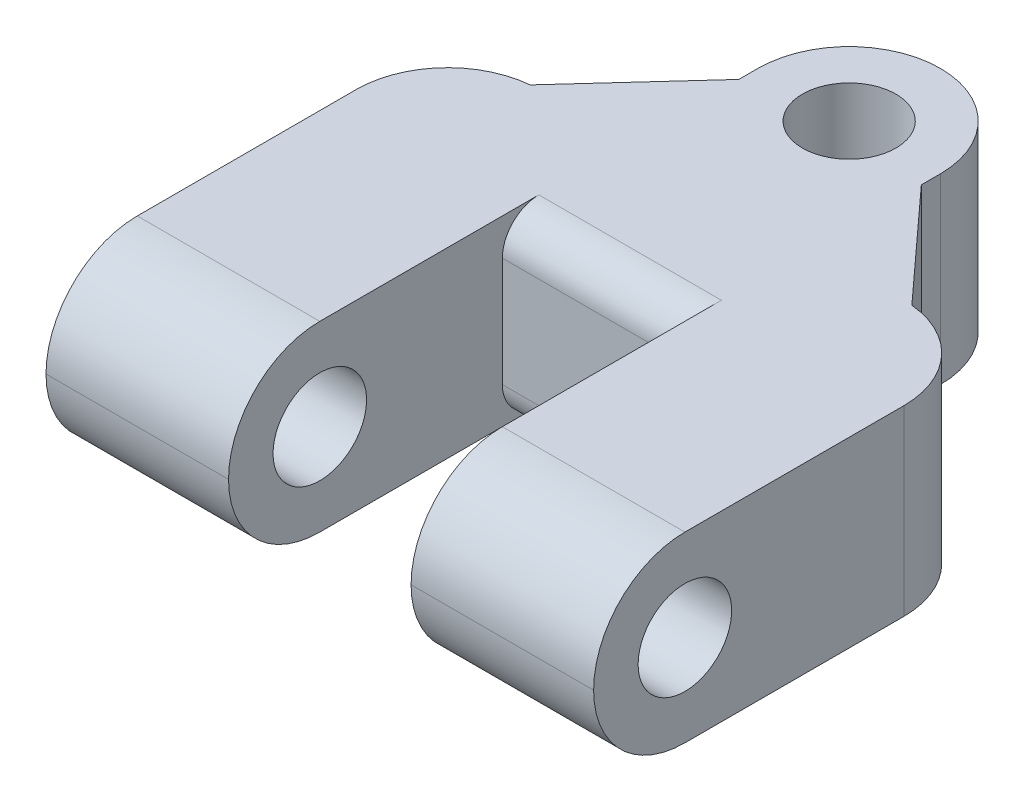
from build123d import *

# Parameters (mm, degrees)
BOSS_EXTRUDE1_DEPTH = 3.175
FILLET1_R           = 3.175
CUT_EXTRUDE1_REACH  = 24.125
SKETCH2_R           = 1.627
SKETCH3_R           = 1.627
CUT_EXTRUDE2_DEPTH  = 6.35
SKETCH4_W           = 6.35
SKETCH4_H           = 6.35
CUT_EXTRUDE3_DEPTH  = 1.905
FILLET2_R           = 1.27
CHAMFER1_START      = -3.175
CHAMFER1_DEPTH      = 6.35


with BuildPart() as part:
    # Sketch1 → Boss-Extrude1 (new, symmetric)
    with BuildSketch(Plane(origin=(0, 0, 0), x_dir=(1, 0, 0), z_dir=(0, 1, 0))):
        Polygon((-3.175, 3.175), (-9.525, 3.175), (-9.525, -3.175), (-9.525, -10.795), (-3.175, -10.795), (-3.175, -3.175), (3.175, -3.175), (3.175, -10.795), (9.525, -10.795), (9.525, -3.175), (9.525, 3.175), (3.175, 3.175), (3.175, 10.795), (-3.175, 10.795), align=None)
    extrude(amount=BOSS_EXTRUDE1_DEPTH, both=True)

    # Fillet1
    fillet1_edges = [part.edges().sort_by_distance(p)[0] for p in [
        (3.175, 0, -10.795),
        (-3.175, 0, -10.795),
        (6.35, -3.175, 10.795),
        (6.35, 3.175, 10.795),
        (-6.35, -3.175, 10.795),
        (-6.35, 3.175, 10.795),
        (-9.525, 0, -3.175),
        (9.525, 0, -3.175),
    ]]
    fillet(fillet1_edges, radius=FILLET1_R - 0.0001)  # a hair under: the kernel refuses the full size

    # Cut-Extrude1: up to this face of the body (flat: up to its plane)
    cut_extrude1_end = Plane(part.part.faces().sort_by_distance((9.525, 0, 5.081615958))[0])
    # Sketch2 → Cut-Extrude1 (cut, up to the picked face)
    with BuildSketch(Plane.ZY.offset(9.525), mode=Mode.PRIVATE) as cut_extrude1_sk1:
        with Locations((7.62, 0)):
            Circle(SKETCH2_R)
    cut_extrude1_tool1 = split(extrude(cut_extrude1_sk1.sketch, amount=-CUT_EXTRUDE1_REACH, mode=Mode.PRIVATE), bisect_by=cut_extrude1_end, keep=Keep.BOTH, mode=Mode.PRIVATE)
    add(cut_extrude1_tool1.solids().sort_by(Axis((-9.525, 0, 7.62), (1, 0, 0)))[0], mode=Mode.SUBTRACT)

    # Sketch3 → Cut-Extrude2 (cut)
    with BuildSketch(Plane(origin=(0, 3.175, 0), x_dir=(1, 0, 0), z_dir=(0, 1, 0))):
        with Locations(Location((0, 7.62, 0), (0, 0, 270))):
            Circle(SKETCH3_R)
    extrude(amount=-CUT_EXTRUDE2_DEPTH, mode=Mode.SUBTRACT)

    # Sketch4 → Cut-Extrude3 (cut)
    with BuildSketch(Plane.XY.offset(3.175)):
        Rectangle(SKETCH4_W, SKETCH4_H)
    extrude(amount=-CUT_EXTRUDE3_DEPTH, mode=Mode.SUBTRACT)

    # Fillet2
    fillet2_edges = [part.edges().sort_by_distance(p)[0] for p in [
        (0, 3.175, 1.27),
        (0, -3.175, 1.27),
    ]]
    fillet(fillet2_edges, radius=FILLET2_R)

    # Chamfer1: read off the stored shape, not the designer's step
    # Chamfer1 outline → Chamfer1 (add)
    with BuildSketch(Plane(origin=(0, 0, 0), x_dir=(1, 0, 0), z_dir=(0, 1, 0)).offset(CHAMFER1_START)):
        with BuildLine():
            Line((6.638636364, 3.161852945), (3.175, 6.95607648))
            Line((3.175, 6.95607648), (3.175, 3.175))
            Line((3.175, 3.175), (6.35, 3.175))
            ThreePointArc((6.35, 3.175), (6.494467813, 3.171711533), (6.638636364, 3.161852945))
        make_face()
        with BuildLine():
            Line((-3.175, 6.95607648), (-6.638636364, 3.161852945))
            ThreePointArc((-6.638636364, 3.161852945), (-6.494467813, 3.171711533), (-6.35, 3.175))
            Line((-6.35, 3.175), (-3.175, 3.175))
            Line((-3.175, 3.175), (-3.175, 6.95607648))
        make_face()
    extrude(amount=CHAMFER1_DEPTH)


solid = part.part
